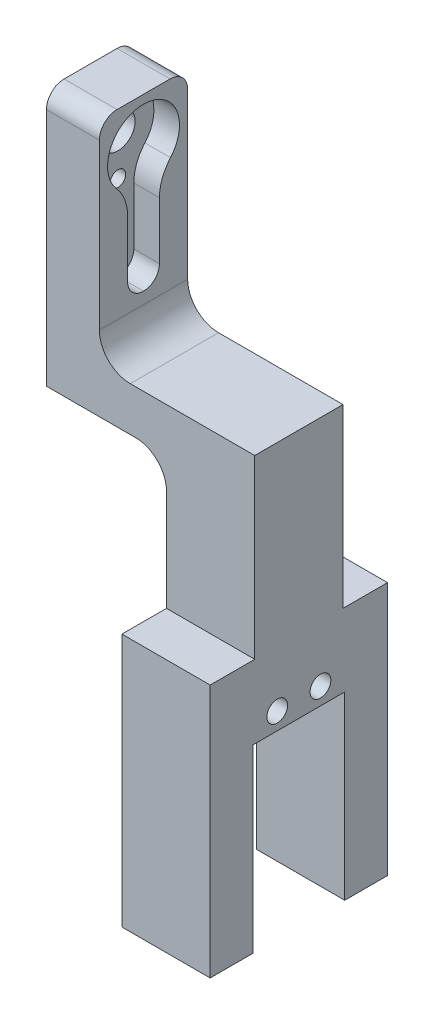
from build123d import *

# Parameters (mm, degrees)
SKETCH1_W            = 20
SKETCH1_H            = 20
BOSS_EXTRUDE1_DEPTH  = 20
SKETCH2_W            = 45
SKETCH2_H            = 70
BOSS_EXTRUDE2_DEPTH  = 12
CUT_EXTRUDE1_DEPTH   = 5.8
FILLET1_R            = 3.6
FILLET2_R            = 10
SKETCH5_R            = 3.9
CUT_EXTRUDE2_DEPTH   = 53.490475326
CUT_EXTRUDE3_REACH   = 51.17
SKETCH6_R            = 1.75
SKETCH7_W            = 12
SKETCH7_H            = 45
CUT_EXTRUDE4_DEPTH   = 4.8
SKETCH9_W            = 12
SKETCH9_H            = 45
CUT_EXTRUDE5_DEPTH   = 23.8
SKETCH10_W           = 12.5
SKETCH10_H           = 41.4
CUT_EXTRUDE6_DEPTH   = 23.8
SKETCH11_W           = 20
SKETCH11_H           = 1.2
CUT_EXTRUDE7_DEPTH   = 23.8
BOSS_EXTRUDE3_START  = 20
SKETCH12_W           = 20
SKETCH12_H           = 20
SKETCH12_R           = 3.9
BOSS_EXTRUDE3_DEPTH  = 20
SKETCH13_W           = 20.2
SKETCH13_H           = 20.2
SKETCH13_R           = 3.9
BOSS_EXTRUDE4_DEPTH  = 40
SKETCH14_W           = 12
SKETCH14_H           = 20
BOSS_EXTRUDE5_DEPTH  = 0.1
SKETCH17_R           = 4.83091966
BOSS_EXTRUDE8_DEPTH  = 39
SKETCH18_W           = 20.2
SKETCH18_H           = 20.2
CUT_EXTRUDE8_DEPTH   = 40
FILLET4_R            = 4
SKETCH20_W           = 12
SKETCH20_H           = 20
BOSS_EXTRUDE9_DEPTH  = 8
SKETCH21_W           = 47.2
SKETCH21_H           = 20
BOSS_EXTRUDE11_DEPTH = 10
SKETCH23_W           = 20
SKETCH23_H           = 20
BOSS_EXTRUDE12_DEPTH = 30
SKETCH25_W           = 20
SKETCH25_H           = 40.2
BOSS_EXTRUDE13_DEPTH = 57.5
SKETCH26_W           = 20
SKETCH26_H           = 20.8
CUT_EXTRUDE9_DEPTH   = 40.9
SKETCH27_R           = 2.35
CUT_EXTRUDE10_DEPTH  = 10
SKETCH28_R           = 2.35
CUT_EXTRUDE11_DEPTH  = 140.85113514
CHAMFER1_SIZE        = 1
FILLET5_R            = 7


with BuildPart() as part:
    # Sketch1 → Boss-Extrude1 (new body)
    with BuildSketch(Plane(origin=(0, 0, 0), x_dir=(0, 0, -1), z_dir=(1, 0, 0))):
        Rectangle(SKETCH1_W, SKETCH1_H)
    extrude(amount=BOSS_EXTRUDE1_DEPTH)

    # Sketch2 → Boss-Extrude2 (add)
    with BuildSketch(Plane(origin=(20, 0, 0), x_dir=(0, 0, -1), z_dir=(1, 0, 0))):
        Rectangle(SKETCH2_W, SKETCH2_H)
    extrude(amount=BOSS_EXTRUDE2_DEPTH)

    # Sketch4 → Cut-Extrude1 (cut)
    with BuildSketch(Plane(origin=(32, 0, 0), x_dir=(0, 0, -1), z_dir=(1, 0, 0))):
        with BuildLine():
            Line((3.6, -28.55), (-3.6, -28.55))
            Line((-3.6, -28.55), (-3.6, -7.311805523))
            ThreePointArc((-3.6, -7.311805523), (0, 8.15), (3.6, -7.311805523))
            Line((3.6, -7.311805523), (3.6, -28.55))
        make_face()
    extrude(amount=-CUT_EXTRUDE1_DEPTH, mode=Mode.SUBTRACT)

    # Fillet1
    fillet1_edges = [part.edges().sort_by_distance(p)[0] for p in [
        (29.1, -28.55, 3.6),
        (29.1, -28.55, -3.6),
    ]]
    fillet(fillet1_edges, radius=FILLET1_R - 0.0001)  # a hair under: the kernel refuses the full size

    # Fillet2
    fillet2_edges = [part.edges().sort_by_distance(p)[0] for p in [
        (29.1, -7.311805523, 3.6),
        (29.1, -7.311805523, -3.6),
    ]]
    fillet(fillet2_edges, radius=FILLET2_R)

    # Sketch5 → Cut-Extrude2 (cut, through all)
    with BuildSketch(Plane.ZY):
        Circle(SKETCH5_R)
    extrude(amount=-CUT_EXTRUDE2_DEPTH, mode=Mode.SUBTRACT)

    # Sketch6 → Cut-Extrude3 (cut, up to next)
    with BuildSketch(Plane(origin=(26.2, 0, 0), x_dir=(0, 0, -1), z_dir=(1, 0, 0)), mode=Mode.PRIVATE) as cut_extrude3_sk1:
        with Locations((0, -20.6)):
            Circle(SKETCH6_R)
    cut_extrude3_tool1 = extrude(cut_extrude3_sk1.sketch, amount=-CUT_EXTRUDE3_REACH, mode=Mode.PRIVATE) & part.part
    # Sketch6 → Cut-Extrude3 (cut, up to next)
    with BuildSketch(Plane(origin=(26.2, 0, 0), x_dir=(0, 0, -1), z_dir=(1, 0, 0)), mode=Mode.PRIVATE) as cut_extrude3_sk2:
        with Locations((0, -9.35)):
            Circle(SKETCH6_R)
    cut_extrude3_tool2 = extrude(cut_extrude3_sk2.sketch, amount=-CUT_EXTRUDE3_REACH, mode=Mode.PRIVATE) & part.part
    add(cut_extrude3_tool1.solids().sort_by_distance((26.2, -20.6, 0))[0], mode=Mode.SUBTRACT)
    add(cut_extrude3_tool2.solids().sort_by_distance((26.2, -9.35, 0))[0], mode=Mode.SUBTRACT)

    # Sketch7 → Cut-Extrude4 (cut)
    with BuildSketch(Plane.XZ.offset(35)):
        with Locations((26, 0)):
            Rectangle(SKETCH7_W, SKETCH7_H)
    extrude(amount=-CUT_EXTRUDE4_DEPTH, mode=Mode.SUBTRACT)

    # Sketch9 → Cut-Extrude5 (cut)
    with BuildSketch(Plane(origin=(0, 35, 0), x_dir=(1, 0, 0), z_dir=(0, 1, 0))):
        with Locations((26, 0)):
            Rectangle(SKETCH9_W, SKETCH9_H)
    extrude(amount=-CUT_EXTRUDE5_DEPTH, mode=Mode.SUBTRACT)

    # Sketch10 → Cut-Extrude6 (cut)
    with BuildSketch(Plane.ZY.offset(-20)):
        with Locations((-16.25, -9.5)):
            Rectangle(SKETCH10_W, SKETCH10_H)
        with Locations((16.25, -9.5)):
            Rectangle(SKETCH10_W, SKETCH10_H)
    extrude(amount=-CUT_EXTRUDE6_DEPTH, mode=Mode.SUBTRACT)

    # Sketch11 → Cut-Extrude7 (cut)
    with BuildSketch(Plane.ZY.offset(-20)):
        with Locations((0, 10.6)):
            Rectangle(SKETCH11_W, SKETCH11_H)
    extrude(amount=-CUT_EXTRUDE7_DEPTH, mode=Mode.SUBTRACT)

    # Sketch12 → Boss-Extrude3 (add)
    with BuildSketch(Plane.ZY.offset(BOSS_EXTRUDE3_START)):
        Rectangle(SKETCH12_W, SKETCH12_H)
        Circle(SKETCH12_R, mode=Mode.SUBTRACT)
    extrude(amount=-BOSS_EXTRUDE3_DEPTH)

    # Sketch13 → Boss-Extrude4 (add)
    with BuildSketch(Plane.ZY.offset(20)):
        Rectangle(SKETCH13_W, SKETCH13_H)
        Circle(SKETCH13_R, mode=Mode.SUBTRACT)
    extrude(amount=-BOSS_EXTRUDE4_DEPTH)

    # Sketch14 → Boss-Extrude5 (add)
    with BuildSketch(Plane(origin=(0, 10, 0), x_dir=(1, 0, 0), z_dir=(0, 1, 0))):
        with Locations((26, 0)):
            Rectangle(SKETCH14_W, SKETCH14_H)
    extrude(amount=BOSS_EXTRUDE5_DEPTH)

    # Sketch17 → Boss-Extrude8 (add)
    with BuildSketch(Plane.ZY.offset(20)):
        Circle(SKETCH17_R)
    extrude(amount=-BOSS_EXTRUDE8_DEPTH)

    # Sketch18 → Cut-Extrude8 (cut)
    with BuildSketch(Plane.ZY.offset(20)):
        Rectangle(SKETCH18_W, SKETCH18_H)
    extrude(amount=-CUT_EXTRUDE8_DEPTH, mode=Mode.SUBTRACT)

    # Fillet4
    fillet4_edges = [part.edges().sort_by_distance(p)[0] for p in [
        (26, 10.1, -10),
        (26, 10.1, 10),
    ]]
    fillet(fillet4_edges, radius=FILLET4_R)

    # Sketch20 → Boss-Extrude9 (add)
    with BuildSketch(Plane.XZ.offset(30.2)):
        with Locations((26, 0)):
            Rectangle(SKETCH20_W, SKETCH20_H)
    extrude(amount=BOSS_EXTRUDE9_DEPTH)

    # Sketch21 → Boss-Extrude11 (add)
    with BuildSketch(Plane.XZ.offset(38.2)):
        with Locations((43.6, 0)):
            Rectangle(SKETCH21_W, SKETCH21_H)
    extrude(amount=BOSS_EXTRUDE11_DEPTH)

    # Sketch23 → Boss-Extrude12 (add)
    with BuildSketch(Plane.XZ.offset(48.2)):
        with Locations((57.2, 0)):
            Rectangle(SKETCH23_W, SKETCH23_H)
    extrude(amount=BOSS_EXTRUDE12_DEPTH)

    # Sketch25 → Boss-Extrude13 (add)
    with BuildSketch(Plane.XZ.offset(78.2)):
        with Locations((57.2, 0)):
            Rectangle(SKETCH25_W, SKETCH25_H)
    extrude(amount=BOSS_EXTRUDE13_DEPTH)

    # Sketch26 → Cut-Extrude9 (cut)
    with BuildSketch(Plane.XZ.offset(135.7)):
        with Locations((57.2, 0)):
            Rectangle(SKETCH26_W, SKETCH26_H)
    extrude(amount=-CUT_EXTRUDE9_DEPTH, mode=Mode.SUBTRACT)

    # Sketch27 → Cut-Extrude10 (cut)
    with BuildSketch(Plane(origin=(0, -135.7, 0), x_dir=(-1, 0, 0), z_dir=(0, -1, 0))):
        with Locations(Location((-57.2, 15.25, 0), (0, 0, 90))):
            Circle(SKETCH27_R)
        with Locations(Location((-57.2, -15.25, 0), (0, 0, 270))):
            Circle(SKETCH27_R)
    extrude(amount=-CUT_EXTRUDE10_DEPTH, mode=Mode.SUBTRACT)

    # Sketch28 → Cut-Extrude11 (cut, through all)
    with BuildSketch(Plane.ZY.offset(-47.2)):
        with Locations((4.9, -90.91)):
            Circle(SKETCH28_R)
        with Locations(Location((-4.9, -90.91, 0), (0, 0, 180))):
            Circle(SKETCH28_R)
    extrude(amount=-CUT_EXTRUDE11_DEPTH, mode=Mode.SUBTRACT)

    # Chamfer1
    chamfer1_edges = [part.edges().sort_by_distance(p)[0] for p in [
        (57.2, -135.7, -12.9),
        (57.2, -135.7, 12.9),
        (47.2, -90.91, 2.55),
        (47.2, -90.91, -2.55),
    ]]
    chamfer(chamfer1_edges, length=CHAMFER1_SIZE)

    # Fillet5
    fillet5_edges = [part.edges().sort_by_distance(p)[0] for p in [
        (32, -38.2, 0),
        (47.2, -48.2, 0),
    ]]
    fillet(fillet5_edges, radius=FILLET5_R)


solid = part.part
